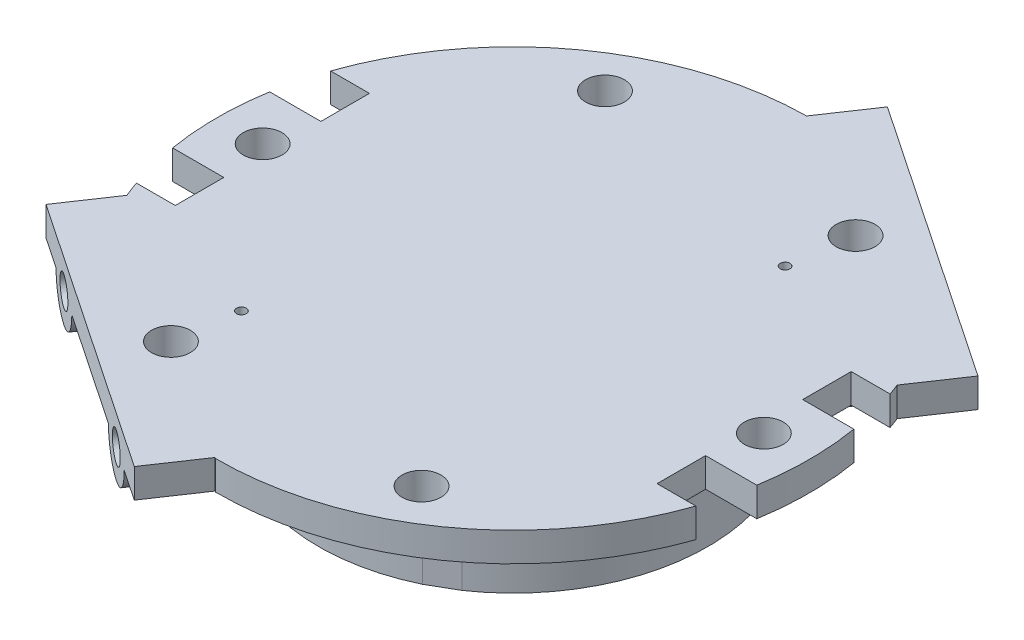
from build123d import *

# Parameters (mm, degrees)
CROQUIS1_R              = 30.5
SALIENTE_EXTRUIR1_DEPTH = 3
CORTAR_EXTRUIR3_START   = -4
CORTAR_EXTRUIR3_DEPTH   = 4
CROQUIS7_R              = 2
CORTAR_EXTRUIR4_DEPTH   = 10
CROQUIS8_R              = 0.5
CORTAR_EXTRUIR5_DEPTH   = 3
SALIENTE_EXTRUIR2_DEPTH = 13
CROQUIS11_W             = 34.583232932
CROQUIS11_H             = 3
SALIENTE_EXTRUIR3_DEPTH = 6
CROQUIS12_R             = 2
CORTAR_EXTRUIR7_DEPTH   = 3
CROQUIS13_R             = 3
SALIENTE_EXTRUIR4_DEPTH = 20
CROQUIS14_R             = 1.5
CORTAR_EXTRUIR8_DEPTH   = 5
CORTAR_EXTRUIR9_START   = -3
CORTAR_EXTRUIR9_DEPTH   = 3
CROQUIS16_W             = 33.68877148
CROQUIS16_H             = 3
SALIENTE_EXTRUIR5_DEPTH = 6
CROQUIS17_R             = 2
CORTAR_EXTRUIR10_DEPTH  = 3
CROQUIS18_R             = 3
SALIENTE_EXTRUIR6_DEPTH = 25
CROQUIS19_R             = 1.5
CORTAR_EXTRUIR11_DEPTH  = 5


with BuildPart() as part:
    # Croquis1 → Saliente-Extruir1 (new body)
    with BuildSketch(Plane(origin=(0, 0, 0), x_dir=(1, 0, 0), z_dir=(0, 1, 0))):
        Circle(CROQUIS1_R)
    extrude(amount=SALIENTE_EXTRUIR1_DEPTH)

    # Croquis5 → Cortar-Extruir3 (cut)
    with BuildSketch(Plane(origin=(0, 3, 0), x_dir=(1, 0, 0), z_dir=(0, 1, 0)).offset(CORTAR_EXTRUIR3_START)):
        with BuildLine():
            Line((30.087372767, -5), (24.814059068, -5))
            Line((24.814059068, -5), (24.814059068, -10))
            Line((24.814059068, -10), (28.814059068, -10))
            ThreePointArc((28.814059068, -10), (29.556634924, -7.526973624), (30.087372767, -5))
        make_face()
        with BuildLine():
            ThreePointArc((-30.087372767, -5), (-29.556634924, -7.526973624), (-28.814059068, -10))
            Line((-28.814059068, -10), (-24.814059068, -10))
            Line((-24.814059068, -10), (-24.814059068, -5))
            Line((-24.814059068, -5), (-30.087372767, -5))
        make_face()
        with BuildLine():
            Line((24.814059068, 5), (30.087372767, 5))
            ThreePointArc((30.087372767, 5), (29.556634924, 7.526973624), (28.814059068, 10))
            Line((28.814059068, 10), (24.814059068, 10))
            Line((24.814059068, 10), (24.814059068, 5))
        make_face()
        with BuildLine():
            ThreePointArc((-28.814059068, 10), (-29.556634924, 7.526973624), (-30.087372767, 5))
            Line((-30.087372767, 5), (-24.814059068, 5))
            Line((-24.814059068, 5), (-24.814059068, 10))
            Line((-24.814059068, 10), (-28.814059068, 10))
        make_face()
    extrude(amount=CORTAR_EXTRUIR3_DEPTH, mode=Mode.SUBTRACT)

    # Croquis7 → Cortar-Extruir4 (cut)
    with BuildSketch(Plane(origin=(0, 3, 0), x_dir=(1, 0, 0), z_dir=(0, 1, 0))):
        with Locations((25.81405907, 0)):
            Circle(CROQUIS7_R)
        with Locations((12.907029535, 22.355630929)):
            Circle(CROQUIS7_R)
        with Locations((12.907029535, -22.355630929)):
            Circle(CROQUIS7_R)
        with Locations((-12.907029535, 22.355630929)):
            Circle(CROQUIS7_R)
        with Locations((-12.907029535, -22.355630929)):
            Circle(CROQUIS7_R)
        with Locations((-25.81405907, 0)):
            Circle(CROQUIS7_R)
    extrude(amount=-CORTAR_EXTRUIR4_DEPTH, mode=Mode.SUBTRACT)

    # Croquis8 → Cortar-Extruir5 (cut)
    with BuildSketch(Plane(origin=(0, 3, 0), x_dir=(1, 0, 0), z_dir=(0, 1, 0))):
        with Locations((12, 16)):
            Circle(CROQUIS8_R)
        with Locations((-12, -16)):
            Circle(CROQUIS8_R)
    extrude(amount=-CORTAR_EXTRUIR5_DEPTH, mode=Mode.SUBTRACT)

    # Croquis9 → Saliente-Extruir2 (add)
    with BuildSketch(Plane(origin=(0, 3, 0), x_dir=(1, 0, 0), z_dir=(0, 1, 0))):
        with BuildLine():
            Line((-8.700961894, 18.070508076), (-10, 17.320508076))
            Line((-10, 17.320508076), (-11.299038106, 16.570508076))
            ThreePointArc((-11.299038106, 16.570508076), (-19.960969499, 1.951844427), (-14.294950117, -14.067849912))
            ThreePointArc((-14.294950117, -14.067849912), (-10.97161543, -13.181769141), (-9, -16))
            ThreePointArc((-9, -16), (-9.12838457, -16.868230859), (-9.502549883, -17.662150088))
            ThreePointArc((-9.502549883, -17.662150088), (-0.449805389, -20.05112653), (8.700961894, -18.070508076))
            Line((8.700961894, -18.070508076), (10, -17.320508076))
            Line((10, -17.320508076), (11.299038106, -16.570508076))
            ThreePointArc((11.299038106, -16.570508076), (17.732250869, -9.371087404), (20.05617112, 0))
            ThreePointArc((20.05617112, 0), (18.560064193, 7.600922125), (14.294950117, 14.067849912))
            ThreePointArc((14.294950117, 14.067849912), (10.2, 13.6), (9.502549883, 17.662150088))
            ThreePointArc((9.502549883, 17.662150088), (0.449805389, 20.05112653), (-8.700961894, 18.070508076))
        make_face()
    extrude(amount=-SALIENTE_EXTRUIR2_DEPTH)

    # Croquis11 → Saliente-Extruir3 (add)
    with BuildSketch(Plane(origin=(14.04954782, 0, -20.829311224), x_dir=(-0.8290375725550414, 0, -0.5591929034707472), z_dir=(0.5591929034707472, 0, -0.8290375725550414))):
        with Locations((0, 1.5)):
            Rectangle(CROQUIS11_W, CROQUIS11_H)
    extrude(amount=SALIENTE_EXTRUIR3_DEPTH)

    # Croquis12 → Cortar-Extruir7 (cut)
    with BuildSketch(Plane(origin=(0, 3, 0), x_dir=(1, 0, 0), z_dir=(0, 1, 0))):
        with Locations((12.907029535, 22.355630929)):
            Circle(CROQUIS12_R)
    extrude(amount=-CORTAR_EXTRUIR7_DEPTH, mode=Mode.SUBTRACT)

    # Croquis13 → Saliente-Extruir4 (add)
    # profile 1 of 2: a face of its own
    with BuildSketch(Plane(origin=(17.404705241, 0, -25.803536659), x_dir=(-0.8290375725550414, 0, -0.5591929034707472), z_dir=(0.5591929034707472, 0, -0.8290375725550414))):
        with Locations((-10, 0)):
            Circle(CROQUIS13_R)
        with BuildLine():
            ThreePointArc((-11.5, 0), (-10, 1.5), (-8.5, 0))
            Line((-8.5, 0), (-11.5, 0))
        make_face(mode=Mode.SUBTRACT)
    # profile 2 of 2: a face of its own
    with BuildSketch(Plane(origin=(17.404705241, 0, -25.803536659), x_dir=(-0.8290375725550414, 0, -0.5591929034707472), z_dir=(0.5591929034707472, 0, -0.8290375725550414))):
        with Locations((10, 0)):
            Circle(CROQUIS13_R)
        with BuildLine():
            ThreePointArc((8.5, 0), (10, 1.5), (11.5, 0))
            Line((11.5, 0), (8.5, 0))
        make_face(mode=Mode.SUBTRACT)
    extrude(amount=-SALIENTE_EXTRUIR4_DEPTH)

    # Croquis14 → Cortar-Extruir8 (cut)
    with BuildSketch(Plane(origin=(17.404705241, 0, -25.803536659), x_dir=(-0.8290375725550414, 0, -0.5591929034707472), z_dir=(0.5591929034707472, 0, -0.8290375725550414))):
        with Locations((-10, 0)):
            Circle(CROQUIS14_R)
        with Locations((10, 0)):
            Circle(CROQUIS14_R)
    extrude(amount=-CORTAR_EXTRUIR8_DEPTH, mode=Mode.SUBTRACT)

    # Croquis15 → Cortar-Extruir9 (cut)
    with BuildSketch(Plane(origin=(0, 3, 0), x_dir=(1, 0, 0), z_dir=(0, 1, 0)).offset(CORTAR_EXTRUIR9_START)):
        with BuildLine():
            ThreePointArc((-28.212513648, -11.588963441), (-17.055383556, -25.285645963), (-0.176506165, -30.499489267))
            Line((-0.176506165, -30.499489267), (-11.071782568, -23.15053254))
            ThreePointArc((-11.071782568, -23.15053254), (-14.025415342, -24.013706075), (-14.331545089, -20.951794957))
            Line((-14.331545089, -20.951794957), (-28.212513648, -11.588963441))
        make_face()
    extrude(amount=CORTAR_EXTRUIR9_DEPTH, mode=Mode.SUBTRACT)

    # Croquis16 → Saliente-Extruir5 (add)
    with BuildSketch(Plane(origin=(-14.194509906, 0, 21.044226354), x_dir=(0.8290375725550415, 0, 0.5591929034707472), z_dir=(-0.5591929034707471, 0, 0.8290375725550414))):
        with Locations((-0.064381976, 1.5)):
            Rectangle(CROQUIS16_W, CROQUIS16_H)
    extrude(amount=SALIENTE_EXTRUIR5_DEPTH)

    # Croquis17 → Cortar-Extruir10 (cut)
    with BuildSketch(Plane(origin=(0, 3, 0), x_dir=(1, 0, 0), z_dir=(0, 1, 0))):
        with Locations((-12.907029535, -22.355630929)):
            Circle(CROQUIS17_R)
    extrude(amount=-CORTAR_EXTRUIR10_DEPTH, mode=Mode.SUBTRACT)

    # Croquis18 → Saliente-Extruir6 (add)
    with BuildSketch(Plane(origin=(-17.549667327, 0, 26.01845179), x_dir=(0.8290375725550416, 0, 0.5591929034707471), z_dir=(-0.5591929034707471, 0, 0.8290375725550416))):
        with Locations((9.935618024, 0)):
            Circle(CROQUIS18_R)
        with Locations((-10.064381976, 0)):
            Circle(CROQUIS18_R)
    extrude(amount=-SALIENTE_EXTRUIR6_DEPTH)

    # Croquis19 → Cortar-Extruir11 (cut)
    with BuildSketch(Plane(origin=(-17.549667327, 0, 26.01845179), x_dir=(0.8290375725550416, 0, 0.5591929034707471), z_dir=(-0.5591929034707471, 0, 0.8290375725550416))):
        with Locations((-10.064381976, 0)):
            Circle(CROQUIS19_R)
        with Locations((9.935618024, 0)):
            Circle(CROQUIS19_R)
    extrude(amount=-CORTAR_EXTRUIR11_DEPTH, mode=Mode.SUBTRACT)


solid = part.part
